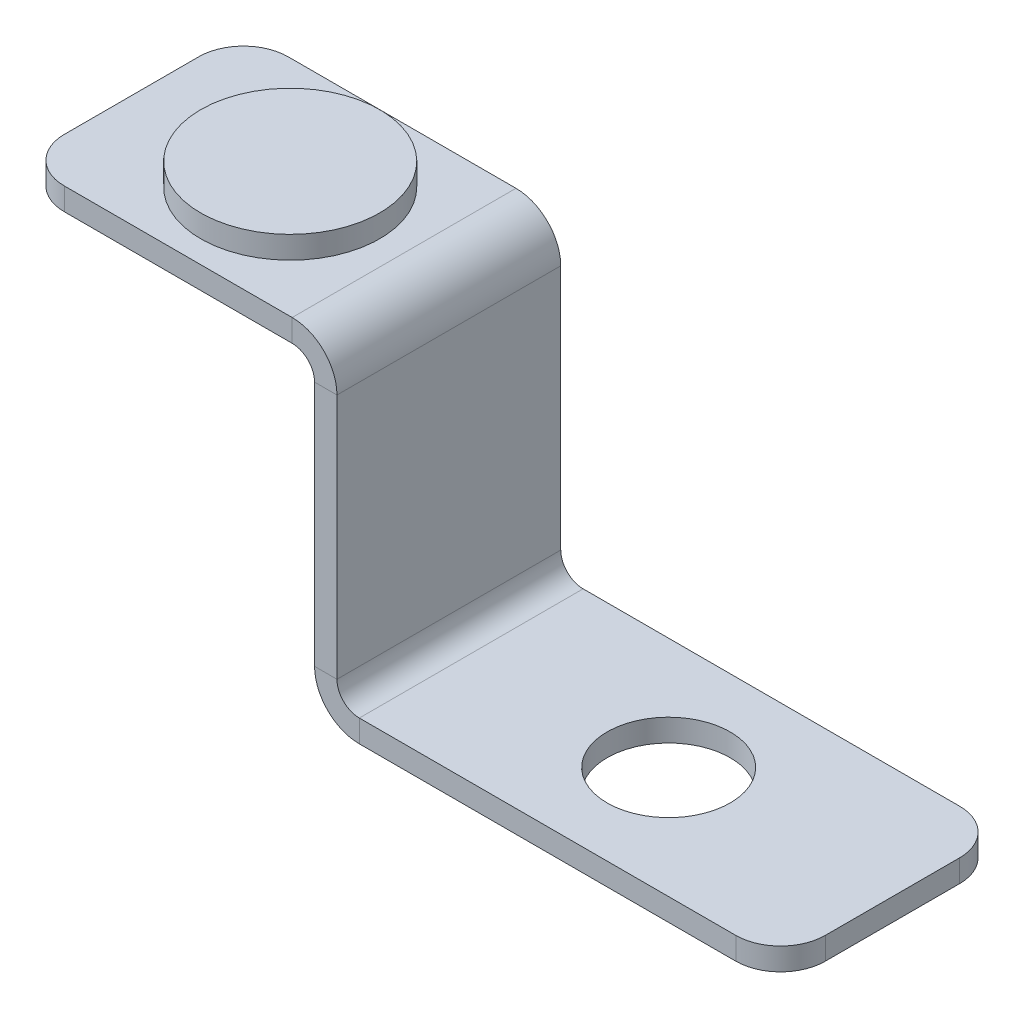
from build123d import *
from build123d.topology import SkipClean

# Parameters (mm, degrees)
SKETCH1_R           = 2.75
BASE_FLANGE1_DEPTH  = 1
JOG1_START          = -10
JOG1_DEPTH          = 10
JOG1_START_2        = -8
JOG1_2_DEPTH        = 6
JOG1_START_3        = 12
JOG1_3_DEPTH        = 1.974011807
JOG1_4_OUTLINE_W    = 1
JOG1_4_OUTLINE_H    = 2
JOG1_4_DEPTH        = 12.152182036
JOG1_START_4        = 13
JOG1_5_DEPTH        = 1
JOG1_6_DEPTH        = 10
JOG1_7_DEPTH        = 10
SKETCH7_R           = 4
BOSS_EXTRUDE1_DEPTH = 1


with BuildPart() as part:
    # Base-Flange1: sheet metal written as solids
    # Sketch1 → Base-Flange1 (new body)
    with BuildSketch(Plane(origin=(0, 0, 0), x_dir=(1, 0, 0), z_dir=(0, 1, 0))):
        with BuildLine():
            Line((2, 0), (32, 0))
            ThreePointArc((32, 0), (33.414213562, 0.585786438), (34, 2))
            Line((34, 2), (34, 8))
            ThreePointArc((34, 8), (33.414213562, 9.414213562), (32, 10))
            Line((32, 10), (2, 10))
            ThreePointArc((2, 10), (0.585786438, 9.414213562), (0, 8))
            Line((0, 8), (0, 2))
            ThreePointArc((0, 2), (0.585786438, 0.585786438), (2, 0))
        make_face()
        with Locations(Location((24, 5, 0), (0, 0, 270))):
            Circle(SKETCH1_R, mode=Mode.SUBTRACT)
    extrude(amount=-BASE_FLANGE1_DEPTH)

    # Jog1: read off the stored shape, not the designer's step
    # Jog1 outline → Jog1 (cut)
    with BuildSketch(Plane.XY.offset(JOG1_START)):
        with BuildLine():
            ThreePointArc((15.178097245, -1), (14.178097245, -0.732050807), (13.446046438, 0))
            Line((13.446046438, 0), (0, 0))
            Line((0, 0), (0, -1))
            Line((0, -1), (15.178097245, -1))
        make_face()
    extrude(amount=JOG1_DEPTH, mode=Mode.SUBTRACT)

    # Jog1 2 outline → Jog1 2 (add)
    with BuildSketch(Plane.XY.offset(JOG1_START_2)):
        with BuildLine():
            Line((14.178097245, 1), (14.178097245, 12))
            ThreePointArc((14.178097245, 12), (13.592310807, 13.414213562), (12.178097245, 14))
            Line((12.178097245, 14), (0, 14))
            Line((0, 14), (0, 13))
            Line((0, 13), (12.178097245, 13))
            ThreePointArc((12.178097245, 13), (12.885204026, 12.707106781), (13.178097245, 12))
            Line((13.178097245, 12), (13.178097245, 1))
            ThreePointArc((13.178097245, 1), (13.246245593, 0.48236191), (13.446046438, 0))
            Line((13.446046438, 0), (15.178097245, 0))
            ThreePointArc((15.178097245, 0), (14.470990464, 0.292893219), (14.178097245, 1))
        make_face()
    extrude(amount=JOG1_2_DEPTH)

    # Jog1 3 outline → Jog1 3 (add)
    with BuildSketch(Plane(origin=(0, 0, 0), x_dir=(1, 0, 0), z_dir=(0, 1, 0)).offset(JOG1_START_3)):
        with BuildLine():
            Line((14.178097245, 8), (14.178097245, 10))
            Line((14.178097245, 10), (2, 10))
            ThreePointArc((2, 10), (0.585786438, 9.414213562), (0, 8))
            Line((0, 8), (14.178097245, 8))
        make_face()
        with BuildLine():
            Line((14.178097245, 0), (14.178097245, 2))
            Line((14.178097245, 2), (0, 2))
            ThreePointArc((0, 2), (0.585786438, 0.585786438), (2, 0))
            Line((2, 0), (14.178097245, 0))
        make_face()
    extrude(amount=JOG1_3_DEPTH)

    # Jog1 4 outline → Jog1 4 (add)
    with BuildSketch(Plane(origin=(0, 0, 0), x_dir=(1, 0, 0), z_dir=(0, 1, 0))):
        with Locations((13.678097245, 9)):
            Rectangle(JOG1_4_OUTLINE_W, JOG1_4_OUTLINE_H)
        with Locations((13.678097245, 1)):
            Rectangle(JOG1_4_OUTLINE_W, JOG1_4_OUTLINE_H)
    extrude(amount=JOG1_4_DEPTH)

    # Jog1 5 outline → Jog1 5 (add)
    with BuildSketch(Plane(origin=(0, 0, 0), x_dir=(1, 0, 0), z_dir=(0, 1, 0)).offset(JOG1_START_4)):
        with BuildLine():
            Line((13.178097245, 8), (13.178097245, 10))
            Line((13.178097245, 10), (2, 10))
            ThreePointArc((2, 10), (0.585786438, 9.414213562), (0, 8))
            Line((0, 8), (13.178097245, 8))
        make_face()
        with BuildLine():
            Line((13.178097245, 0), (13.178097245, 2))
            Line((13.178097245, 2), (0, 2))
            ThreePointArc((0, 2), (0.585786438, 0.585786438), (2, 0))
            Line((2, 0), (13.178097245, 0))
        make_face()
    extrude(amount=JOG1_5_DEPTH)

    # Jog1 6 outline → Jog1 6 (cut)
    with SkipClean():  # the faces are left unmerged after this step: merging them gives an invalid solid
        with BuildSketch(Plane.XY.offset(JOG1_START)):
            with BuildLine():
                ThreePointArc((14.178097249, -0.732050809), (13.763883685, -0.414213564), (13.446046438, 0))
                ThreePointArc((13.446046438, 0), (13.246245593, 0.48236191), (13.178097245, 1))
                Line((13.178097245, 1), (13.178097245, 12))
                ThreePointArc((13.178097245, 12), (12.885204026, 12.707106781), (12.178097245, 13))
                Line((12.178097245, 13), (-1, 13))
                Line((-1, 13), (-1, -2))
                Line((-1, -2), (14.17809725, -2))
                Line((14.17809725, -2), (14.178097249, -0.732050809))
            make_face()
            with BuildLine():
                Line((14.178097245, 13.974011807), (13.178097245, 13.974011807))
                Line((13.178097245, 13.974011807), (13.178097245, 14))
                Line((13.178097245, 14), (13.178097236, 15))
                Line((13.178097236, 15), (-1, 15))
                Line((-1, 15), (-1, 14.000000008))
                Line((-1, 14.000000008), (12.178097245, 14))
                ThreePointArc((12.178097245, 14), (13.592310807, 13.414213562), (14.178097245, 12))
                Line((14.178097245, 12), (14.178097245, 13.974011807))
            make_face()
        extrude(amount=JOG1_6_DEPTH, mode=Mode.SUBTRACT)
    add(part.part.scale(1), mode=Mode.REPLACE)  # the faces are merged on a copy

    # Jog1 7 outline → Jog1 7 (add)
    with SkipClean():  # the faces are left unmerged after this step: merging them gives an invalid solid
        with BuildSketch(Plane.XY.offset(JOG1_START)):
            with BuildLine():
                Line((14.178097253, 0), (14.178097249, -0.732050809))
                ThreePointArc((14.178097249, -0.732050809), (14.660459157, -0.931851653), (15.178097245, -1))
                Line((15.178097245, -1), (17, -1.000000001))
                Line((17, -1.000000001), (17, -1e-09))
                Line((17, -1e-09), (15.178097245, 0))
                ThreePointArc((15.178097245, 0), (14.470990464, 0.292893219), (14.178097245, 1))
                Line((14.178097245, 1), (14.178097253, 0))
            make_face()
        extrude(amount=JOG1_7_DEPTH)
    add(part.part.scale(1), mode=Mode.REPLACE)  # the faces are merged on a copy


with BuildPart() as body_2:
    # Sketch7 → Boss-Extrude1 (new body)
    with BuildSketch(Plane(origin=(0, 14, 0), x_dir=(1, 0, 0), z_dir=(0, 1, 0))):
        with Locations(Location((7.089048623, 5, 0), (0, 0, 180))):
            Circle(SKETCH7_R)
    extrude(amount=BOSS_EXTRUDE1_DEPTH)


solid = Compound([part.part, body_2.part])
